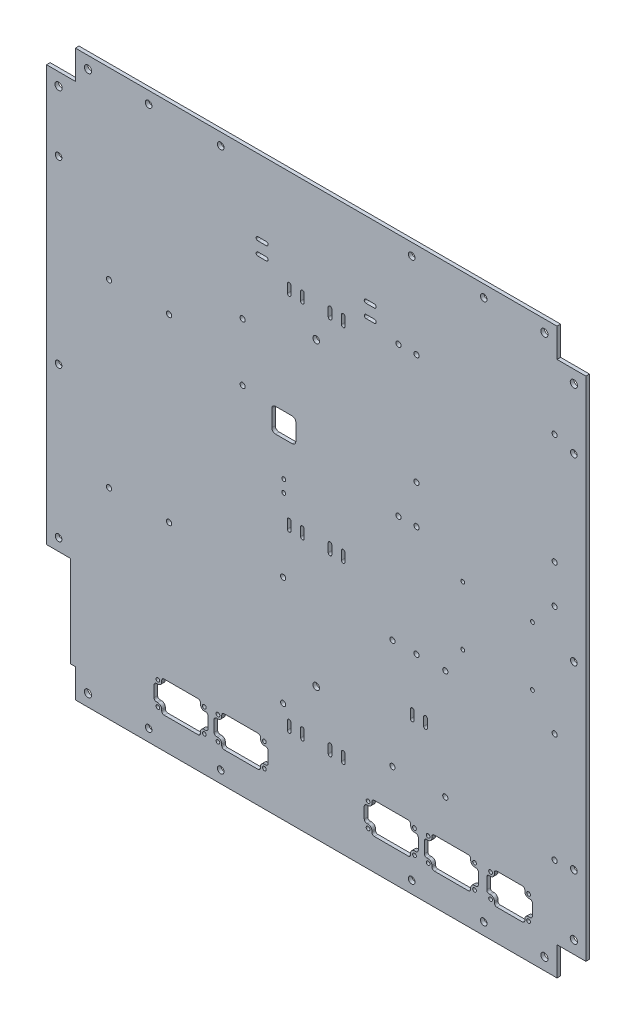
from build123d import *

# Parameters (mm, degrees)
SKETCH2_W                                      = 449
SKETCH2_H                                      = 470
BOSS_EXTRUDE1_DEPTH                            = 3
M5_CLEARANCE_HOLE1_D                           = 5.5
EXTRUDER_PANEL_CUTOUTS_DEPTH                   = 651.007692262
Z_MOTOR_PANEL_CUTOUT_DEPTH                     = 10
FILLET1_R                                      = 3.175
SKETCH17_R                                     = 1.55
CUT_EXTRUDE3_DEPTH                             = 651.007692262
SKETCH7_R                                      = 2.15
DUET2_MOUNTING_HOLES_DEPTH                     = 651.007692262
SKETCH9_R                                      = 2.2
PSU_MOUNTING_HOLES_DEPTH                       = 651.007692262
SKETCH11_R                                     = 2.15
SSR_HOLES_DEPTH                                = 651.007692262
SKETCH18_R                                     = 2.15
SKETCH18_R_2                                   = 1.6
DUET3_EXPANDERS_AND_RASPI_HOLES_DEPTH          = 651.007692262
SKETCH12_R                                     = 3
INSIDE_CORNER_BRACKET_SCREW_CLEARANCE_HO_DEPTH = 651.007692262
SKETCH6_W                                      = 3
SKETCH6_H                                      = 10
SKETCH6_W_2                                    = 10
SKETCH6_H_2                                    = 3
MAIN_WIRING_TIE_DOWNS_DEPTH                    = 651.007692262
SKETCH13_W                                     = 24
SKETCH13_H                                     = 24
CUT_EXTRUDE1_DEPTH                             = 651.007692262
FILLET3_R                                      = 2
FILLET4_R                                      = 1.5
SKETCH19_W                                     = 20
SKETCH19_H                                     = 100
POWER_INLET_SOCKET_CUTOUT_DEPTH                = 651.007692262
SKETCH20_W                                     = 20
SKETCH20_H                                     = 20
CUT_EXTRUDE5_DEPTH                             = 651.007692262
FILLET6_R                                      = 3
SKETCH22_R                                     = 1.6
CABLE_CHAIN_ATTACHMENT_POINTS_DEPTH            = 651.007692262


with BuildPart() as part:
    # Sketch2 → Boss-Extrude1 (new body)
    with BuildSketch(Plane.XY):
        with Locations((224.5, 235)):
            Rectangle(SKETCH2_W, SKETCH2_H)
    extrude(amount=BOSS_EXTRUDE1_DEPTH)

    # M5 Clearance Hole1 (through all)
    with Locations(Plane(origin=(0, 0, 0), x_dir=(-1, 0, 0), z_dir=(0, 0, -1))):
        with Locations((-10, 235), (-224.5, 360), (-224.5, 110), (-364, 460), (-85, 460), (-304, 460), (-145, 460), (-85, 10), (-145, 10), (-304, 10), (-364, 10), (-439, 385), (-439, 85), (-10, 110), (-10, 385), (-439, 235)):
            Hole(M5_CLEARANCE_HOLE1_D / 2)

    # Sketch10 → extruder panel cutouts (cut, through all)
    with BuildSketch(Plane(origin=(0, 0, 0), x_dir=(-1, 0, 0), z_dir=(0, 0, -1))):
        Polygon((-128.15, 52), (-128.15, 45.65), (-134.5, 45.65), (-134.5, 32.35), (-128.15, 32.35), (-128.15, 26), (-95.85, 26), (-95.85, 32.35), (-89.5, 32.35), (-89.5, 45.65), (-95.85, 45.65), (-95.85, 52), align=None)
        Polygon((-178.15, 52), (-178.15, 45.65), (-184.5, 45.65), (-184.5, 32.35), (-178.15, 32.35), (-178.15, 26), (-145.85, 26), (-145.85, 32.35), (-139.5, 32.35), (-139.5, 45.65), (-145.85, 45.65), (-145.85, 52), align=None)
        Polygon((-303.15, 52), (-270.85, 52), (-270.85, 45.65), (-264.5, 45.65), (-264.5, 32.35), (-270.85, 32.35), (-270.85, 26), (-303.15, 26), (-303.15, 32.35), (-309.5, 32.35), (-309.5, 45.65), (-303.15, 45.65), align=None)
        Polygon((-353.15, 52), (-320.85, 52), (-320.85, 45.65), (-314.5, 45.65), (-314.5, 32.35), (-320.85, 32.35), (-320.85, 26), (-353.15, 26), (-353.15, 32.35), (-359.5, 32.35), (-359.5, 45.65), (-353.15, 45.65), align=None)
    extrude(amount=-EXTRUDER_PANEL_CUTOUTS_DEPTH, mode=Mode.SUBTRACT)

    # Sketch16 → z_motor_panel_cutout (cut)
    with BuildSketch(Plane(origin=(0, 0, 0), x_dir=(-1, 0, 0), z_dir=(0, 0, -1))):
        Polygon((-398.15, 52), (-398.15, 45.65), (-404.5, 45.65), (-404.5, 32.35), (-398.15, 32.35), (-398.15, 26), (-372.85, 26), (-372.85, 32.35), (-366.5, 32.35), (-366.5, 45.65), (-372.85, 45.65), (-372.85, 52), align=None)
    extrude(amount=-Z_MOTOR_PANEL_CUTOUT_DEPTH, mode=Mode.SUBTRACT)

    # Fillet1
    fillet1_edges = [part.edges().sort_by_distance(p)[0] for p in [
        (95.85, 45.65, 1.5),
        (95.85, 32.35, 1.5),
        (128.15, 32.35, 1.5),
        (128.15, 45.65, 1.5),
        (145.85, 45.65, 1.5),
        (145.85, 32.35, 1.5),
        (178.15, 32.35, 1.5),
        (178.15, 45.65, 1.5),
        (303.15, 45.65, 1.5),
        (270.85, 45.65, 1.5),
        (270.85, 32.35, 1.5),
        (303.15, 32.35, 1.5),
        (353.15, 45.65, 1.5),
        (320.85, 45.65, 1.5),
        (320.85, 32.35, 1.5),
        (353.15, 32.35, 1.5),
        (372.85, 45.65, 1.5),
        (372.85, 32.35, 1.5),
        (398.15, 32.35, 1.5),
        (398.15, 45.65, 1.5),
    ]]
    fillet(fillet1_edges, radius=FILLET1_R)

    # Sketch17 → Cut-Extrude3 (cut, through all)
    with BuildSketch(Plane(origin=(0, 0, 0), x_dir=(-1, 0, 0), z_dir=(0, 0, -1))):
        with Locations((-401.325, 48.825)):
            Circle(SKETCH17_R)
        with Locations((-369.675, 48.825)):
            Circle(SKETCH17_R)
        with Locations((-369.675, 29.175)):
            Circle(SKETCH17_R)
        with Locations((-401.325, 29.175)):
            Circle(SKETCH17_R)
        with Locations((-356.325, 48.825)):
            Circle(SKETCH17_R)
        with Locations((-317.675, 48.825)):
            Circle(SKETCH17_R)
        with Locations((-317.675, 29.175)):
            Circle(SKETCH17_R)
        with Locations((-356.325, 29.175)):
            Circle(SKETCH17_R)
        with Locations((-306.325, 48.825)):
            Circle(SKETCH17_R)
        with Locations((-267.675, 48.825)):
            Circle(SKETCH17_R)
        with Locations((-267.675, 29.175)):
            Circle(SKETCH17_R)
        with Locations((-306.325, 29.175)):
            Circle(SKETCH17_R)
        with Locations((-181.325, 48.825)):
            Circle(SKETCH17_R)
        with Locations((-142.675, 48.825)):
            Circle(SKETCH17_R)
        with Locations((-142.675, 29.175)):
            Circle(SKETCH17_R)
        with Locations((-181.325, 29.175)):
            Circle(SKETCH17_R)
        with Locations((-131.325, 48.825)):
            Circle(SKETCH17_R)
        with Locations((-92.675, 48.825)):
            Circle(SKETCH17_R)
        with Locations((-92.675, 29.175)):
            Circle(SKETCH17_R)
        with Locations((-131.325, 29.175)):
            Circle(SKETCH17_R)
    extrude(amount=-CUT_EXTRUDE3_DEPTH, mode=Mode.SUBTRACT)

    # Sketch7 → Duet2 mounting holes (cut, through all)
    with BuildSketch(Plane(origin=(0, 0, 0), x_dir=(-1, 0, 0), z_dir=(0, 0, -1))):
        with Locations((-423, 391)):
            Circle(SKETCH7_R)
        with Locations((-308, 391)):
            Circle(SKETCH7_R)
        with Locations((-308, 299)):
            Circle(SKETCH7_R)
        with Locations((-423, 299)):
            Circle(SKETCH7_R)
        with Locations((-423, 267)):
            Circle(SKETCH7_R)
        with Locations((-308, 267)):
            Circle(SKETCH7_R)
        with Locations((-308, 175)):
            Circle(SKETCH7_R)
        with Locations((-423, 175)):
            Circle(SKETCH7_R)
    extrude(amount=-DUET2_MOUNTING_HOLES_DEPTH, mode=Mode.SUBTRACT)

    # Sketch9 → psu mounting holes (cut, through all)
    with BuildSketch(Plane(origin=(0, 0, 0), x_dir=(-1, 0, 0), z_dir=(0, 0, -1))):
        with Locations((-52, 317)):
            Circle(SKETCH9_R)
        with Locations((-102, 317)):
            Circle(SKETCH9_R)
        with Locations((-52, 167)):
            Circle(SKETCH9_R)
        with Locations((-102, 167)):
            Circle(SKETCH9_R)
    extrude(amount=-PSU_MOUNTING_HOLES_DEPTH, mode=Mode.SUBTRACT)

    # Sketch11 → ssr holes (cut, through all)
    with BuildSketch(Plane(origin=(0, 0, 0), x_dir=(-1, 0, 0), z_dir=(0, 0, -1))):
        with Locations((-163.25, 344.4)):
            Circle(SKETCH11_R)
        with Locations((-163.25, 296.4)):
            Circle(SKETCH11_R)
    extrude(amount=-SSR_HOLES_DEPTH, mode=Mode.SUBTRACT)

    # Sketch18 → Duet3, Expanders, and Raspi Holes (cut, through all)
    with BuildSketch(Plane(origin=(0, 0, 0), x_dir=(-1, 0, 0), z_dir=(0, 0, -1))):
        with Locations((-293, 391)):
            Circle(SKETCH18_R)
        with Locations((-293, 267)):
            Circle(SKETCH18_R)
        with Locations((-404.5, 246.5)):
            Circle(SKETCH18_R_2)
        with Locations((-346.5, 246.5)):
            Circle(SKETCH18_R_2)
        with Locations((-346.5, 197.5)):
            Circle(SKETCH18_R_2)
        with Locations((-404.5, 197.5)):
            Circle(SKETCH18_R_2)
        with Locations((-332, 175)):
            Circle(SKETCH18_R)
        with Locations((-332, 84)):
            Circle(SKETCH18_R)
        with Locations((-423, 84)):
            Circle(SKETCH18_R)
        with Locations((-288, 175)):
            Circle(SKETCH18_R)
        with Locations((-288, 84)):
            Circle(SKETCH18_R)
        with Locations((-197, 84)):
            Circle(SKETCH18_R)
        with Locations((-197, 175)):
            Circle(SKETCH18_R)
    extrude(amount=-DUET3_EXPANDERS_AND_RASPI_HOLES_DEPTH, mode=Mode.SUBTRACT)

    # Sketch12 → inside corner bracket screw clearance ho (cut, through all)
    with BuildSketch(Plane(origin=(0, 0, 0), x_dir=(-1, 0, 0), z_dir=(0, 0, -1))):
        with Locations((-414.5, 460)):
            Circle(SKETCH12_R)
        with Locations((-34.5, 460)):
            Circle(SKETCH12_R)
        with Locations((-439, 435.5)):
            Circle(SKETCH12_R)
        with Locations((-439, 34.5)):
            Circle(SKETCH12_R)
        with Locations((-414.5, 10)):
            Circle(SKETCH12_R)
        with Locations((-34.5, 10)):
            Circle(SKETCH12_R)
        with Locations((-10, 34.5)):
            Circle(SKETCH12_R)
        with Locations((-10, 435.5)):
            Circle(SKETCH12_R)
    extrude(amount=-INSIDE_CORNER_BRACKET_SCREW_CLEARANCE_HO_DEPTH, mode=Mode.SUBTRACT)

    # Sketch6 → main wiring tie-downs (cut, through all)
    with BuildSketch(Plane(origin=(0, 0, 0), x_dir=(-1, 0, 0), z_dir=(0, 0, -1))):
        with Locations((-247, 215)):
            Rectangle(SKETCH6_W, SKETCH6_H)
        with Locations((-236, 385)):
            Rectangle(SKETCH6_W, SKETCH6_H)
        with Locations((-247, 385)):
            Rectangle(SKETCH6_W, SKETCH6_H)
        with Locations((-236, 215)):
            Rectangle(SKETCH6_W, SKETCH6_H)
        with Locations((-213, 215)):
            Rectangle(SKETCH6_W, SKETCH6_H)
        with Locations((-202, 215)):
            Rectangle(SKETCH6_W, SKETCH6_H)
        with Locations((-202, 385)):
            Rectangle(SKETCH6_W, SKETCH6_H)
        with Locations((-213, 385)):
            Rectangle(SKETCH6_W, SKETCH6_H)
        with Locations((-247, 70)):
            Rectangle(SKETCH6_W, SKETCH6_H)
        with Locations((-236, 70)):
            Rectangle(SKETCH6_W, SKETCH6_H)
        with Locations((-213, 70)):
            Rectangle(SKETCH6_W, SKETCH6_H)
        with Locations((-179.5, 408.5)):
            Rectangle(SKETCH6_W_2, SKETCH6_H_2)
        with Locations((-269.5, 397.5)):
            Rectangle(SKETCH6_W_2, SKETCH6_H_2)
        with Locations((-269.5, 408.5)):
            Rectangle(SKETCH6_W_2, SKETCH6_H_2)
        with Locations((-179.5, 397.5)):
            Rectangle(SKETCH6_W_2, SKETCH6_H_2)
        with Locations((-202, 70)):
            Rectangle(SKETCH6_W, SKETCH6_H)
        with Locations((-315.5, 129.5)):
            Rectangle(SKETCH6_W, SKETCH6_H)
        with Locations((-304.5, 129.5)):
            Rectangle(SKETCH6_W, SKETCH6_H)
    extrude(amount=-MAIN_WIRING_TIE_DOWNS_DEPTH, mode=Mode.SUBTRACT)

    # Sketch13 → Cut-Extrude1 (cut, through all)
    with BuildSketch(Plane(origin=(0, 0, 0), x_dir=(-1, 0, 0), z_dir=(0, 0, -1))):
        with Locations((-437, 12)):
            Rectangle(SKETCH13_W, SKETCH13_H)
        with Locations((-12, 12)):
            Rectangle(SKETCH13_W, SKETCH13_H)
        with Locations((-437, 458)):
            Rectangle(SKETCH13_W, SKETCH13_H)
        with Locations((-12, 458)):
            Rectangle(SKETCH13_W, SKETCH13_H)
    extrude(amount=-CUT_EXTRUDE1_DEPTH, mode=Mode.SUBTRACT)

    # Fillet3
    fillet3_edges = [part.edges().sort_by_distance(p)[0] for p in [
        (128.15, 52, 1.5),
        (95.85, 52, 1.5),
        (89.5, 45.65, 1.5),
        (89.5, 32.35, 1.5),
        (95.85, 26, 1.5),
        (128.15, 26, 1.5),
        (134.5, 32.35, 1.5),
        (134.5, 45.65, 1.5),
        (178.15, 52, 1.5),
        (145.85, 52, 1.5),
        (139.5, 45.65, 1.5),
        (139.5, 32.35, 1.5),
        (145.85, 26, 1.5),
        (178.15, 26, 1.5),
        (184.5, 32.35, 1.5),
        (184.5, 45.65, 1.5),
        (303.15, 52, 1.5),
        (270.85, 52, 1.5),
        (264.5, 45.65, 1.5),
        (264.5, 32.35, 1.5),
        (270.85, 26, 1.5),
        (303.15, 26, 1.5),
        (309.5, 32.35, 1.5),
        (309.5, 45.65, 1.5),
        (353.15, 52, 1.5),
        (320.85, 52, 1.5),
        (314.5, 45.65, 1.5),
        (314.5, 32.35, 1.5),
        (320.85, 26, 1.5),
        (353.15, 26, 1.5),
        (359.5, 32.35, 1.5),
        (359.5, 45.65, 1.5),
        (398.15, 52, 1.5),
        (372.85, 52, 1.5),
        (366.5, 45.65, 1.5),
        (366.5, 32.35, 1.5),
        (372.85, 26, 1.5),
        (398.15, 26, 1.5),
        (404.5, 32.35, 1.5),
        (404.5, 45.65, 1.5),
    ]]
    fillet(fillet3_edges, radius=FILLET3_R)

    # Fillet4
    fillet4_edges = [part.edges().sort_by_distance(p)[0] for p in [
        (200.5, 210, 1.5),
        (211.5, 210, 1.5),
        (234.5, 210, 1.5),
        (245.5, 210, 1.5),
        (248.5, 210, 1.5),
        (237.5, 210, 1.5),
        (214.5, 210, 1.5),
        (203.5, 210, 1.5),
        (203.5, 220, 1.5),
        (214.5, 220, 1.5),
        (237.5, 220, 1.5),
        (248.5, 220, 1.5),
        (245.5, 220, 1.5),
        (234.5, 220, 1.5),
        (211.5, 220, 1.5),
        (200.5, 220, 1.5),
        (264.5, 399, 1.5),
        (264.5, 410, 1.5),
        (274.5, 407, 1.5),
        (274.5, 396, 1.5),
        (274.5, 399, 1.5),
        (274.5, 410, 1.5),
        (264.5, 396, 1.5),
        (264.5, 407, 1.5),
        (245.5, 380, 1.5),
        (234.5, 380, 1.5),
        (237.5, 380, 1.5),
        (248.5, 380, 1.5),
        (234.5, 390, 1.5),
        (245.5, 390, 1.5),
        (237.5, 390, 1.5),
        (248.5, 390, 1.5),
        (214.5, 390, 1.5),
        (211.5, 390, 1.5),
        (211.5, 380, 1.5),
        (214.5, 380, 1.5),
        (203.5, 380, 1.5),
        (203.5, 390, 1.5),
        (200.5, 390, 1.5),
        (200.5, 380, 1.5),
        (174.5, 396, 1.5),
        (174.5, 399, 1.5),
        (184.5, 399, 1.5),
        (184.5, 396, 1.5),
        (184.5, 407, 1.5),
        (174.5, 407, 1.5),
        (174.5, 410, 1.5),
        (184.5, 410, 1.5),
        (214.5, 65, 1.5),
        (211.5, 65, 1.5),
        (214.5, 75, 1.5),
        (211.5, 75, 1.5),
        (200.5, 75, 1.5),
        (203.5, 75, 1.5),
        (203.5, 65, 1.5),
        (200.5, 65, 1.5),
        (245.5, 65, 1.5),
        (248.5, 65, 1.5),
        (248.5, 75, 1.5),
        (245.5, 75, 1.5),
        (237.5, 65, 1.5),
        (234.5, 65, 1.5),
        (237.5, 75, 1.5),
        (234.5, 75, 1.5),
        (317, 134.5, 1.5),
        (314, 134.5, 1.5),
        (306, 134.5, 1.5),
        (303, 134.5, 1.5),
        (317, 124.5, 1.5),
        (314, 124.5, 1.5),
        (306, 124.5, 1.5),
        (303, 124.5, 1.5),
    ]]
    fillet(fillet4_edges, radius=FILLET4_R - 0.0001)  # a hair under: the kernel refuses the full size

    # Sketch19 → power inlet socket cutout (cut, through all)
    with BuildSketch(Plane(origin=(0, 0, 0), x_dir=(-1, 0, 0), z_dir=(0, 0, -1))):
        with Locations((-10, 50)):
            Rectangle(SKETCH19_W, SKETCH19_H)
    extrude(amount=-POWER_INLET_SOCKET_CUTOUT_DEPTH, mode=Mode.SUBTRACT)

    # Sketch20 → Cut-Extrude5 (cut, through all)
    with BuildSketch(Plane(origin=(0, 0, 0), x_dir=(-1, 0, 0), z_dir=(0, 0, -1))):
        with Locations((-197.5, 285)):
            Rectangle(SKETCH20_W, SKETCH20_H)
    extrude(amount=-CUT_EXTRUDE5_DEPTH, mode=Mode.SUBTRACT)

    # Fillet6
    fillet6_edges = [part.edges().sort_by_distance(p)[0] for p in [
        (187.5, 295, 1.5),
        (187.5, 275, 1.5),
        (207.5, 275, 1.5),
        (207.5, 295, 1.5),
    ]]
    fillet(fillet6_edges, radius=FILLET6_R)

    # Sketch22 → Cable Chain Attachment Points (cut, through all)
    with BuildSketch(Plane(origin=(0, 0, 0), x_dir=(-1, 0, 0), z_dir=(0, 0, -1))):
        with Locations((-197.5, 246)):
            Circle(SKETCH22_R)
        with Locations((-197.5, 236)):
            Circle(SKETCH22_R)
    extrude(amount=-CABLE_CHAIN_ATTACHMENT_POINTS_DEPTH, mode=Mode.SUBTRACT)


solid = part.part
